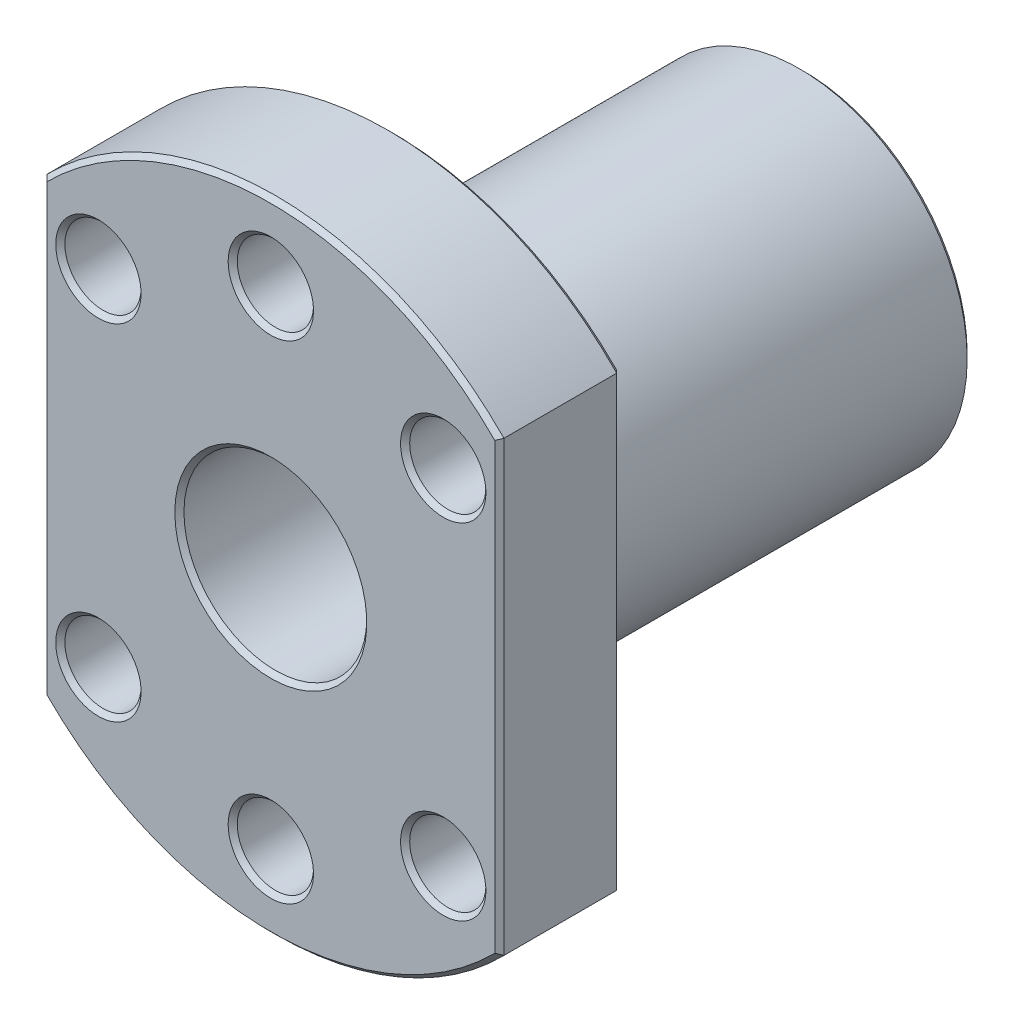
from build123d import *

# Parameters (mm, degrees)
CUT_EXTRUDE1_DEPTH      = 35.471002306
CUT_EXTRUDE1_DEPTH_BACK = 35.471002306
SKETCH2_W               = 6
SKETCH2_H               = 8
SKETCH3_R               = 2.5
CUT_EXTRUDE2_DEPTH      = 10
CHAMFER1_SIZE           = 0.3


with BuildPart() as part:
    # Sketch1 → Revolve1 (revolve)
    with BuildSketch(Plane(origin=(0, 0, 0), x_dir=(0, 0, -1), z_dir=(1, 0, 0))):
        Polygon((17.5, 6), (-17.5, 6), (-17.5, 21), (-9.5, 21), (-9.5, 11), (17.5, 11), align=None)
    revolve(axis=Axis((0, 0, 27), (0, 0, -1)))

    # Sketch2 → Cut-Extrude1 (cut, two sides: drawn at the far end of the back side and taken through both)
    with BuildSketch(Plane(origin=(0, 0, 0), x_dir=(1, 0, 0), z_dir=(0, 1, 0)).offset(-CUT_EXTRUDE1_DEPTH_BACK)):
        with Locations((-18, -13.5)):
            Rectangle(SKETCH2_W, SKETCH2_H)
        with Locations((18, -13.5)):
            Rectangle(SKETCH2_W, SKETCH2_H)
    extrude(amount=CUT_EXTRUDE1_DEPTH + CUT_EXTRUDE1_DEPTH_BACK, mode=Mode.SUBTRACT)

    # Sketch3 → Cut-Extrude2 (cut)
    with BuildSketch(Plane.XY.offset(17.5)):
        with Locations((0, 16)):
            Circle(SKETCH3_R)
        with Locations((11.313708499, 11.313708499)):
            Circle(SKETCH3_R)
        with Locations((11.313708499, -11.313708499)):
            Circle(SKETCH3_R)
        with Locations((0, -16)):
            Circle(SKETCH3_R)
        with Locations((-11.313708499, -11.313708499)):
            Circle(SKETCH3_R)
        with Locations((-11.313708499, 11.313708499)):
            Circle(SKETCH3_R)
    extrude(amount=-CUT_EXTRUDE2_DEPTH, mode=Mode.SUBTRACT)

    # Chamfer1
    chamfer1_edges = [part.edges().sort_by_distance(p)[0] for p in [
        (0, -11, 9.5),
        (-15, 0, 9.5),
        (0, -21, 9.5),
        (15, 0, 9.5),
        (0, 21, 9.5),
        (-2.5, 16, 9.5),
        (-13.813708499, 11.313708499, 9.5),
        (-13.813708499, -11.313708499, 9.5),
        (-2.5, -16, 9.5),
        (8.813708499, -11.313708499, 9.5),
        (8.813708499, 11.313708499, 9.5),
        (-15, 0, 17.5),
        (0, 21, 17.5),
        (15, 0, 17.5),
        (0, -21, 17.5),
        (0, -6, 17.5),
        (-2.5, 16, 17.5),
        (-13.813708499, 11.313708499, 17.5),
        (-13.813708499, -11.313708499, 17.5),
        (-2.5, -16, 17.5),
        (8.813708499, -11.313708499, 17.5),
        (8.813708499, 11.313708499, 17.5),
        (0, -6, -17.5),
        (0, -11, -17.5),
    ]]
    chamfer(chamfer1_edges, length=CHAMFER1_SIZE)


solid = part.part
